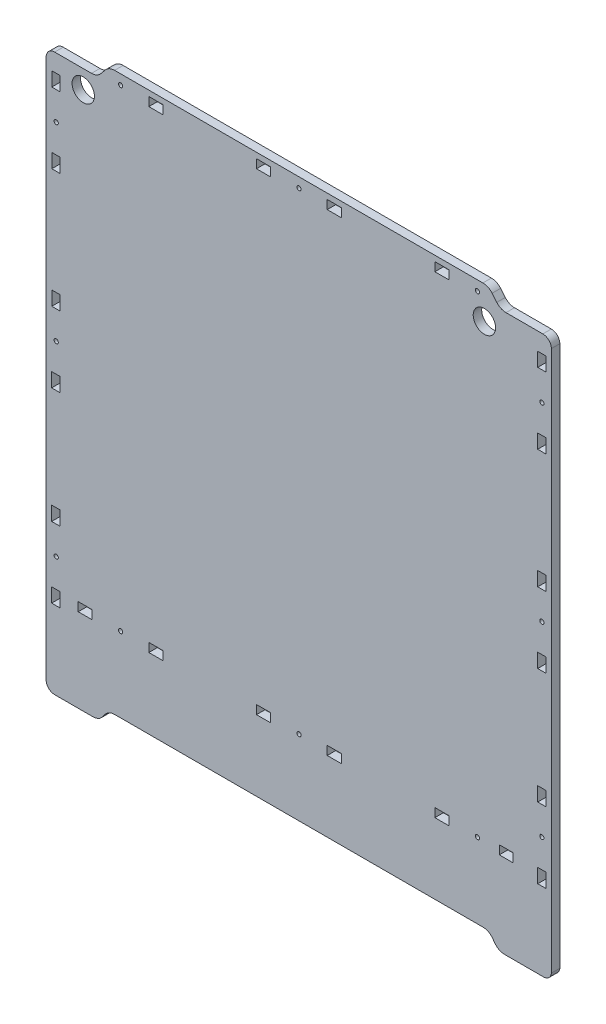
from build123d import *

# Parameters (mm, degrees)
SKETCH_1_R      = 1.5
SKETCH_1_R_2    = 7.9
SKETCH_1_W      = 5.906395822
SKETCH_1_H      = 10
SKETCH_1_W_2    = 6.021531284
SKETCH_1_W_3    = 9.974357274
SKETCH_1_H_2    = 6.199787221
SKETCH_1_W_4    = 9.96963529
SKETCH_1_W_5    = 9.994814167
SKETCH_1_H_3    = 6.199822499
SKETCH_1_W_6    = 9.849167249
SKETCH_1_W_7    = 9.971716679
SKETCH_1_H_4    = 6.19978722
SKETCH_1_W_8    = 9.849167498
SKETCH_1_W_9    = 9.976438662
SKETCH_1_W_10   = 6
SKETCH_1_W_11   = 9.949996323
SKETCH_1_W_12   = 6.011865173
SKETCH_1_W_13   = 9.973103267
EXTRUDE_1_DEPTH = 6


with BuildPart() as part:
    # Эскиз1 → Бобышка-Вытянуть1 (new body)
    with BuildSketch(Plane.XY):
        with BuildLine():
            Line((146.883483371, 191.542952802), (172.919868277, 191.542952802))
            ThreePointArc((172.919868277, 191.542952802), (177.162508964, 189.785593489), (178.919868277, 185.542952802))
            Line((178.919868277, 185.542952802), (178.919868277, -196.675834418))
            ThreePointArc((178.919868277, -196.675834418), (176.974422984, -200.464395383), (172.919868277, -201.767674974))
            Line((172.919868277, -201.767674974), (145.883483371, -201.767674974))
            ThreePointArc((145.883483371, -201.767674974), (142.291228146, -200.971291164), (139.372105604, -198.731369657))
            Line((139.372105604, -198.731369657), (137.076279551, -195.711716561))
            ThreePointArc((137.076279551, -195.711716561), (134.15715701, -193.471795054), (130.564901785, -192.675411244))
            Line((130.564901785, -192.675411244), (-129.725165232, -192.675411244))
            ThreePointArc((-129.725165232, -192.675411244), (-133.317420457, -193.471795054), (-136.236542998, -195.711716561))
            Line((-136.236542998, -195.711716561), (-138.532369051, -198.731369657))
            ThreePointArc((-138.532369051, -198.731369657), (-141.451491593, -200.971291164), (-145.043746818, -201.767674974))
            Line((-145.043746818, -201.767674974), (-172.080131723, -201.767674974))
            ThreePointArc((-172.080131723, -201.767674974), (-176.322772411, -200.010315661), (-178.080131723, -195.767674974))
            Line((-178.080131723, -195.767674974), (-178.080131723, 185.542952802))
            ThreePointArc((-178.080131723, 185.542952802), (-176.322772411, 189.785593489), (-172.080131723, 191.542952802))
            Line((-172.080131723, 191.542952802), (-146.043746818, 191.542952802))
            ThreePointArc((-146.043746818, 191.542952802), (-142.451491593, 192.339336612), (-139.532369051, 194.57925812))
            Line((-139.532369051, 194.57925812), (-136.236542998, 198.507070659))
            ThreePointArc((-136.236542998, 198.507070659), (-133.317420457, 200.746992167), (-129.725165232, 201.543375977))
            Line((-129.725165232, 201.543375977), (130.564901785, 201.543375977))
            ThreePointArc((130.564901785, 201.543375977), (134.15715701, 200.746992167), (137.076279551, 198.507070659))
            Line((137.076279551, 198.507070659), (140.372105604, 194.57925812))
            ThreePointArc((140.372105604, 194.57925812), (143.291228146, 192.339336612), (146.883483371, 191.542952802))
        make_face()
        with Locations((126.685666009, -139.542345576)):
            Circle(SKETCH_1_R, mode=Mode.SUBTRACT)
        with Locations((0.618552859, -139.542345576)):
            Circle(SKETCH_1_R, mode=Mode.SUBTRACT)
        with Locations((-125.506683527, -139.542345576)):
            Circle(SKETCH_1_R, mode=Mode.SUBTRACT)
        with Locations((-170.998595463, -116.688777493)):
            Circle(SKETCH_1_R, mode=Mode.SUBTRACT)
        with Locations((-170.998595463, 15.097079606)):
            Circle(SKETCH_1_R, mode=Mode.SUBTRACT)
        with Locations((172.230572408, 149.197770037)):
            Circle(SKETCH_1_R, mode=Mode.SUBTRACT)
        with Locations((126.704950995, 194.580646485)):
            Circle(SKETCH_1_R, mode=Mode.SUBTRACT)
        with Locations((-151.880131723, 178.543375977)):
            Circle(SKETCH_1_R_2, mode=Mode.SUBTRACT)
        with Locations((172.230572408, -116.688777493)):
            Circle(SKETCH_1_R, mode=Mode.SUBTRACT)
        with Locations((172.230572408, 15.032858644)):
            Circle(SKETCH_1_R, mode=Mode.SUBTRACT)
        with Locations((-170.998595463, 149.170519857)):
            Circle(SKETCH_1_R, mode=Mode.SUBTRACT)
        with Locations((-125.467806558, 194.580646485)):
            Circle(SKETCH_1_R, mode=Mode.SUBTRACT)
        with Locations((0.600947786, 194.580646485)):
            Circle(SKETCH_1_R, mode=Mode.SUBTRACT)
        with Locations((131.619868277, 178.543375977)):
            Circle(SKETCH_1_R_2, mode=Mode.SUBTRACT)
        with Locations((-171.149018725, 39.945179349)):
            Rectangle(SKETCH_1_W, SKETCH_1_H, mode=Mode.SUBTRACT)
        with Locations((172.309102635, 39.945179349)):
            Rectangle(SKETCH_1_W_2, SKETCH_1_H, mode=Mode.SUBTRACT)
        Polygon((175.310202166, 179.116657649), (175.319868277, 169.343375977), (175.310202166, 169.267313763), (169.298336993, 169.267313763), (169.298336993, 179.116657649), align=None, mode=Mode.SUBTRACT)
        Polygon((96.620692742, 197.626307922), (106.419868277, 197.643375977), (106.620692742, 197.626307922), (106.620692742, 191.426520702), (106.419868277, 191.443375977), (96.620692742, 191.426520702), align=None, mode=Mode.SUBTRACT)
        with Locations((25.533740214, -139.575517633)):
            Rectangle(SKETCH_1_W_3, SKETCH_1_H_2, mode=Mode.SUBTRACT)
        with Locations((-24.46393863, -139.575517633)):
            Rectangle(SKETCH_1_W_4, SKETCH_1_H_2, mode=Mode.SUBTRACT)
        with Locations((-171.149018725, 174.116657649)):
            Rectangle(SKETCH_1_W, SKETCH_1_H, mode=Mode.SUBTRACT)
        with Locations((101.618099825, -139.576911106)):
            Rectangle(SKETCH_1_W_5, SKETCH_1_H_3, mode=Mode.SUBTRACT)
        with Locations((147.077476572, -139.576911106)):
            Rectangle(SKETCH_1_W_6, SKETCH_1_H_3, mode=Mode.SUBTRACT)
        with Locations((-24.462897936, 194.528813201)):
            Rectangle(SKETCH_1_W_7, SKETCH_1_H_4, mode=Mode.SUBTRACT)
        with Locations((-171.149018725, 124.116792939)):
            Rectangle(SKETCH_1_W, SKETCH_1_H, mode=Mode.SUBTRACT)
        with Locations((-150.498155392, -139.576911106)):
            Rectangle(SKETCH_1_W_8, SKETCH_1_H_3, mode=Mode.SUBTRACT)
        with Locations((25.534780908, 194.528813201)):
            Rectangle(SKETCH_1_W_9, SKETCH_1_H_4, mode=Mode.SUBTRACT)
        with Locations((-171.195820814, -10.054861749)):
            Rectangle(SKETCH_1_W_10, SKETCH_1_H, mode=Mode.SUBTRACT)
        with Locations((-171.195820814, -91.77600848)):
            Rectangle(SKETCH_1_W_10, SKETCH_1_H, mode=Mode.SUBTRACT)
        with Locations((-171.195820814, -141.776049579)):
            Rectangle(SKETCH_1_W_10, SKETCH_1_H, mode=Mode.SUBTRACT)
        with Locations((-100.548530817, -139.576911106)):
            Rectangle(SKETCH_1_W_11, SKETCH_1_H_3, mode=Mode.SUBTRACT)
        with Locations((172.309102635, -10.054861749)):
            Rectangle(SKETCH_1_W_2, SKETCH_1_H, mode=Mode.SUBTRACT)
        with Locations((172.309102635, -91.77600848)):
            Rectangle(SKETCH_1_W_2, SKETCH_1_H, mode=Mode.SUBTRACT)
        with Locations((172.309102635, -141.776049579)):
            Rectangle(SKETCH_1_W_2, SKETCH_1_H, mode=Mode.SUBTRACT)
        with Locations((172.30426958, 124.116792939)):
            Rectangle(SKETCH_1_W_12, SKETCH_1_H, mode=Mode.SUBTRACT)
        with Locations((-100.536977345, 194.526414312)):
            Rectangle(SKETCH_1_W_13, SKETCH_1_H_4, mode=Mode.SUBTRACT)
    extrude(amount=EXTRUDE_1_DEPTH)


solid = part.part
